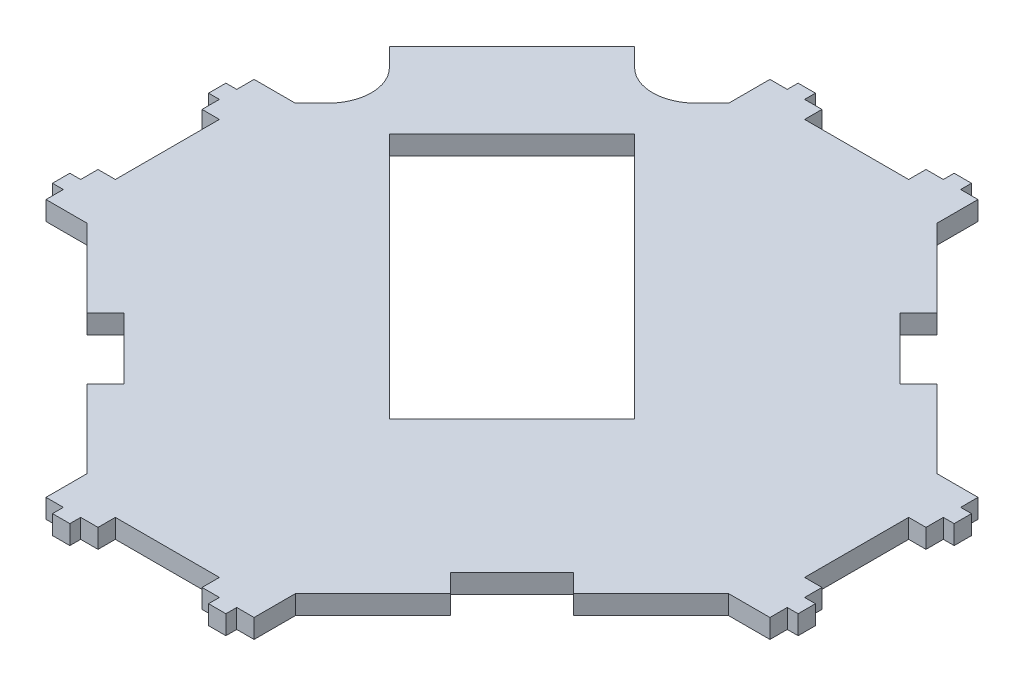
from build123d import *

# Parameters (mm, degrees)
BOSS_EXTRUDE1_DEPTH = 2.2


with BuildPart() as part:
    # Sketch1 → Boss-Extrude1 (new body)
    with BuildSketch(Plane(origin=(0, 0, 0), x_dir=(1, 0, 0), z_dir=(0, 1, 0))):
        with BuildLine():
            Line((37.582177134, 8.383040278), (37.582177134, 10.383040278))
            Line((37.582177134, 10.383040278), (32.832177134, 10.383040278))
            Line((32.832177134, 10.383040278), (23.86771104, 19.347506372))
            Line((23.86771104, 19.347506372), (21.746390696, 17.226186028))
            Line((21.746390696, 17.226186028), (14.675322884, 24.29725384))
            Line((14.675322884, 24.29725384), (16.796643228, 26.418574184))
            Line((16.796643228, 26.418574184), (7.832177134, 35.383040278))
            Line((7.832177134, 35.383040278), (7.832177134, 40.133040278))
            Line((7.832177134, 40.133040278), (5.832177134, 40.133040278))
            Line((5.832177134, 40.133040278), (5.832177134, 41.383040278))
            Line((5.832177134, 41.383040278), (3.832177134, 41.383040278))
            Line((3.832177134, 41.383040278), (3.832177134, 40.133040278))
            Line((3.832177134, 40.133040278), (1.832177134, 40.133040278))
            Line((1.832177134, 40.133040278), (1.832177134, 38.133040278))
            Line((1.832177134, 38.133040278), (-10.167822866, 38.133040278))
            Line((-10.167822866, 38.133040278), (-10.167822866, 40.133040278))
            Line((-10.167822866, 40.133040278), (-12.167822866, 40.133040278))
            Line((-12.167822866, 40.133040278), (-12.167822866, 41.383040278))
            Line((-12.167822866, 41.383040278), (-14.167822866, 41.383040278))
            Line((-14.167822866, 41.383040278), (-14.167822866, 40.133040278))
            Line((-14.167822866, 40.133040278), (-16.167822866, 40.133040278))
            Line((-16.167822866, 40.133040278), (-16.167822866, 35.383040278))
            Line((-16.167822866, 35.383040278), (-18.061221148, 33.489641996))
            ThreePointArc((-18.061221148, 33.489641996), (-21.596755054, 32.025175902), (-25.13228896, 33.489641996))
            Line((-25.13228896, 33.489641996), (-27.253609304, 35.610962339))
            Line((-27.253609304, 35.610962339), (-41.395744928, 21.468826716))
            Line((-41.395744928, 21.468826716), (-39.274424584, 19.347506372))
            ThreePointArc((-39.274424584, 19.347506372), (-37.80995849, 15.811972466), (-39.274424584, 12.27643856))
            Line((-39.274424584, 12.27643856), (-41.167822866, 10.383040278))
            Line((-41.167822866, 10.383040278), (-45.917822866, 10.383040278))
            Line((-45.917822866, 10.383040278), (-45.917822866, 8.383040278))
            Line((-45.917822866, 8.383040278), (-47.167822866, 8.383040278))
            Line((-47.167822866, 8.383040278), (-47.167822866, 6.383040278))
            Line((-47.167822866, 6.383040278), (-45.917822866, 6.383040278))
            Line((-45.917822866, 6.383040278), (-45.917822866, 4.383040278))
            Line((-45.917822866, 4.383040278), (-43.917822866, 4.383040278))
            Line((-43.917822866, 4.383040278), (-43.917822866, -7.616959722))
            Line((-43.917822866, -7.616959722), (-45.917822866, -7.616959722))
            Line((-45.917822866, -7.616959722), (-45.917822866, -9.616959722))
            Line((-45.917822866, -9.616959722), (-47.167822866, -9.616959722))
            Line((-47.167822866, -9.616959722), (-47.167822866, -11.616959722))
            Line((-47.167822866, -11.616959722), (-45.917822866, -11.616959722))
            Line((-45.917822866, -11.616959722), (-45.917822866, -13.616959722))
            Line((-45.917822866, -13.616959722), (-41.167822866, -13.616959722))
            Line((-41.167822866, -13.616959722), (-32.203356772, -22.581425816))
            Line((-32.203356772, -22.581425816), (-30.082036429, -20.460105473))
            Line((-30.082036429, -20.460105473), (-23.010968617, -27.531173284))
            Line((-23.010968617, -27.531173284), (-25.13228896, -29.652493628))
            Line((-25.13228896, -29.652493628), (-16.167822866, -38.616959722))
            Line((-16.167822866, -38.616959722), (-16.167822866, -43.366959722))
            Line((-16.167822866, -43.366959722), (-14.167822866, -43.366959722))
            Line((-14.167822866, -43.366959722), (-14.167822866, -44.616959722))
            Line((-14.167822866, -44.616959722), (-12.167822866, -44.616959722))
            Line((-12.167822866, -44.616959722), (-12.167822866, -43.366959722))
            Line((-12.167822866, -43.366959722), (-10.167822866, -43.366959722))
            Line((-10.167822866, -43.366959722), (-10.167822866, -41.366959722))
            Line((-10.167822866, -41.366959722), (1.832177134, -41.366959722))
            Line((1.832177134, -41.366959722), (1.832177134, -43.366959722))
            Line((1.832177134, -43.366959722), (3.832177134, -43.366959722))
            Line((3.832177134, -43.366959722), (3.832177134, -44.616959722))
            Line((3.832177134, -44.616959722), (5.832177134, -44.616959722))
            Line((5.832177134, -44.616959722), (5.832177134, -43.366959722))
            Line((5.832177134, -43.366959722), (7.832177134, -43.366959722))
            Line((7.832177134, -43.366959722), (7.832177134, -38.616959722))
            Line((7.832177134, -38.616959722), (16.796643228, -29.652493628))
            Line((16.796643228, -29.652493628), (14.675322884, -27.531173284))
            Line((14.675322884, -27.531173284), (21.746390696, -20.460105473))
            Line((21.746390696, -20.460105473), (23.86771104, -22.581425816))
            Line((23.86771104, -22.581425816), (32.832177134, -13.616959722))
            Line((32.832177134, -13.616959722), (37.582177134, -13.616959722))
            Line((37.582177134, -13.616959722), (37.582177134, -11.616959722))
            Line((37.582177134, -11.616959722), (38.832177134, -11.616959722))
            Line((38.832177134, -11.616959722), (38.832177134, -9.616959722))
            Line((38.832177134, -9.616959722), (37.582177134, -9.616959722))
            Line((37.582177134, -9.616959722), (37.582177134, -7.616959722))
            Line((37.582177134, -7.616959722), (35.582177134, -7.616959722))
            Line((35.582177134, -7.616959722), (35.582177134, 4.383040278))
            Line((35.582177134, 4.383040278), (37.582177134, 4.383040278))
            Line((37.582177134, 4.383040278), (37.582177134, 6.383040278))
            Line((37.582177134, 6.383040278), (38.832177134, 6.383040278))
            Line((38.832177134, 6.383040278), (38.832177134, 8.383040278))
            Line((38.832177134, 8.383040278), (37.582177134, 8.383040278))
        make_face()
        Polygon((-4.167822866, -15.759095346), (-32.664226148, 12.737307936), (-18.522090524, 26.87944356), (9.974312757, -1.616959722), align=None, mode=Mode.SUBTRACT)
    extrude(amount=BOSS_EXTRUDE1_DEPTH)


solid = part.part
